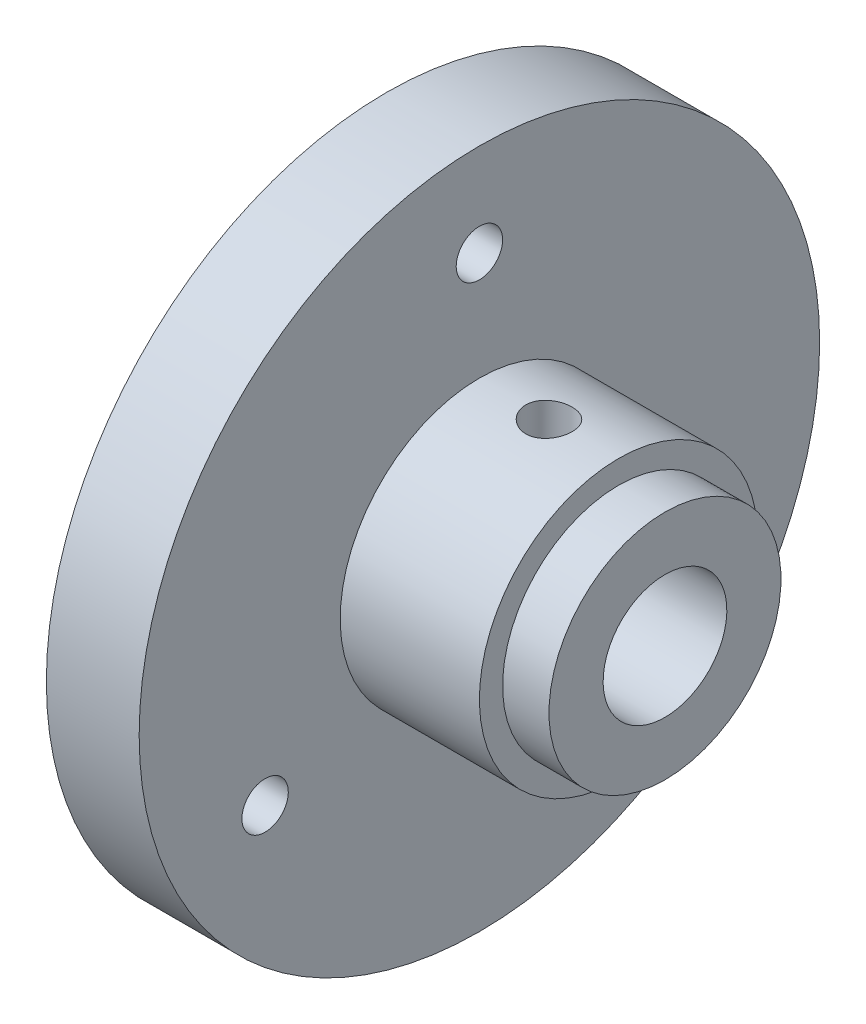
from build123d import *

# Parameters (mm, degrees)
ESQUISSE2_R             = 1.5
ENL_V_MAT_EXTRU_1_DEPTH = 34.346664001
ENL_V_MAT_EXTRU_2_REACH = 44.059
ESQUISSE3_R             = 1.5


with BuildPart() as part:
    # Esquisse1 → Révolution1 (revolve)
    with BuildSketch(Plane.XY):
        Polygon((0, 4), (-18, 4), (-18, 22), (-12, 22), (-12, 9), (-3, 9), (-3, 7.5), (0, 7.5), align=None)
    revolve(axis=Axis((0, 0, 0), (-1, 0, 0)))

    # Esquisse2 → Enlèv. mat.-Extru.1 (cut, through all)
    with BuildSketch(Plane(origin=(-12, 0, 0), x_dir=(0, 0, -1), z_dir=(1, 0, 0))):
        with Locations((0, 16)):
            Circle(ESQUISSE2_R)
        with Locations((13.856406461, -8)):
            Circle(ESQUISSE2_R)
        with Locations((-13.856406461, -8)):
            Circle(ESQUISSE2_R)
    extrude(amount=-ENL_V_MAT_EXTRU_1_DEPTH, mode=Mode.SUBTRACT)

    # Esquisse3 → Enlèv. mat.-Extru.2 (cut, up to next)
    with BuildSketch(Plane(origin=(0, 9, 0), x_dir=(1, 0, 0), z_dir=(0, 1, 0)), mode=Mode.PRIVATE) as enl_v_mat_extru_2_sk1:
        with Locations((-7.5, 0)):
            Circle(ESQUISSE3_R)
    enl_v_mat_extru_2_tool1 = extrude(enl_v_mat_extru_2_sk1.sketch, amount=-ENL_V_MAT_EXTRU_2_REACH, mode=Mode.PRIVATE) & part.part
    add(enl_v_mat_extru_2_tool1.solids().sort_by_distance((-7.5, 9, 0))[0], mode=Mode.SUBTRACT)


solid = part.part
